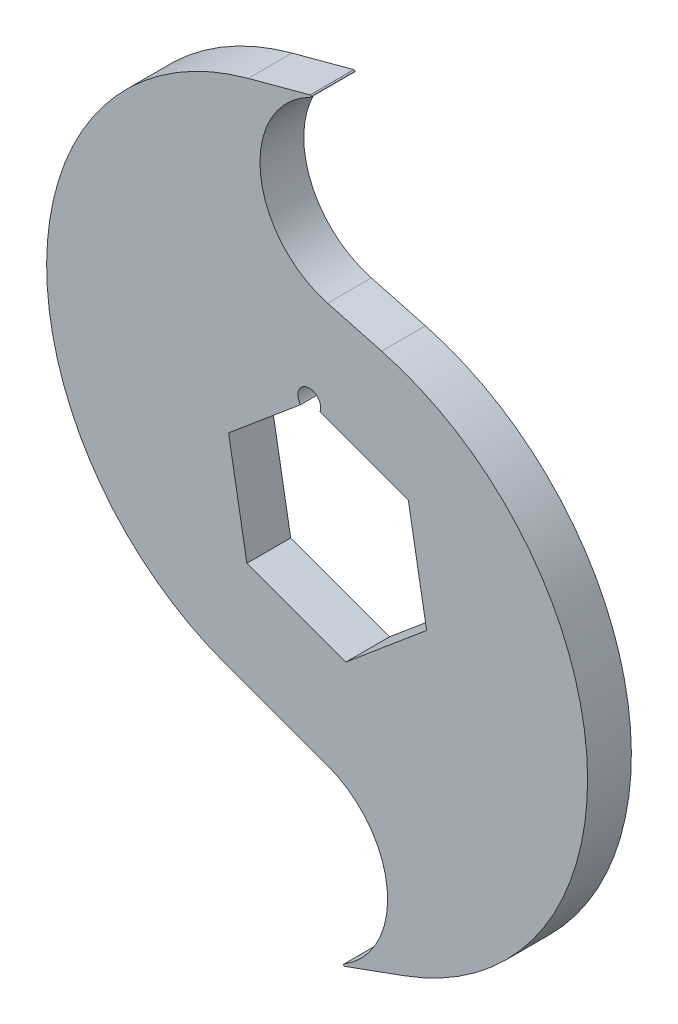
from build123d import *

# Parameters (mm, degrees)
BOSS_EXTRUDE1_DEPTH = 3.048
FILLET1_R           = 0.127


with BuildPart() as part:
    # Sketch1 → Boss-Extrude1 (new, symmetric)
    with BuildSketch(Plane.XY):
        with BuildLine():
            ThreePointArc((0, 27.535484012), (-9.412998127, 39.802742006), (0, 52.07))
            Line((0, 52.07), (-11.040532194, 49.111698314))
            ThreePointArc((-11.040532194, 49.111698314), (-39.066320922, 14.192289272), (-14.190605813, -23.03684931))
            Line((-14.190605813, -23.03684931), (0, -28.201807432))
            ThreePointArc((0, -28.201807432), (8.35634418, -40.135903716), (0, -52.07))
            Line((0, -52.07), (10.740686656, -48.160709762))
            ThreePointArc((10.740686656, -48.160709762), (36.144496882, -10.141220984), (7.52373904, 25.519504212))
            Line((7.52373904, 25.519504212), (0, 27.535484012))
        make_face()
        with BuildLine():
            Line((-13.780307404, 5.015621714), (-3.762593435, 13.421481811))
            ThreePointArc((-3.762593435, 13.421481811), (-3.089454859, 15.933669177), (-0.958997882, 14.441907141))
            ThreePointArc((-0.958997882, 14.441907141), (-0.983115574, 14.166240659), (-1.054735846, 13.898950164))
            Line((-1.054735846, 13.898950164), (11.233809522, 9.426285427))
            Line((11.233809522, 9.426285427), (13.780307404, -5.015621714))
            Line((13.780307404, -5.015621714), (2.546497882, -14.441907141))
            Line((2.546497882, -14.441907141), (-11.233809522, -9.426285427))
            Line((-11.233809522, -9.426285427), (-13.780307404, 5.015621714))
        make_face(mode=Mode.SUBTRACT)
    extrude(amount=BOSS_EXTRUDE1_DEPTH, both=True)

    # Fillet1
    fillet1_edges = [part.edges().sort_by_distance(p)[0] for p in [
        (0, 52.07, 0),
        (0, -52.07, 0),
    ]]
    fillet(fillet1_edges, radius=FILLET1_R)


solid = part.part
